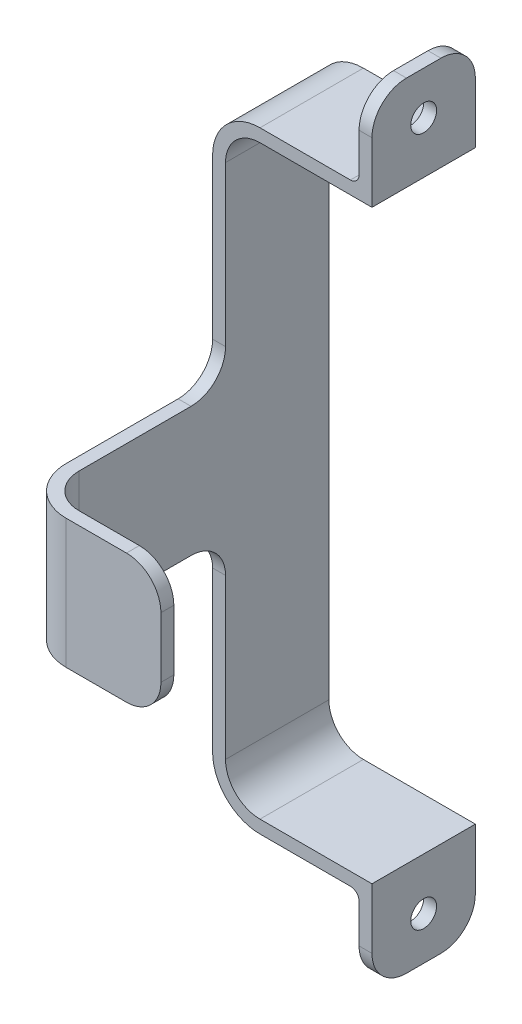
from build123d import *

# Parameters (mm, degrees)
EXTRU_MINCE1_DEPTH      = 6
EXTRU_MINCE2_DEPTH      = 7.5
CONG_1_R                = 4
CONG_2_R                = 1
ESQUISSE3_R             = 1.5
ENL_V_MAT_EXTRU_1_DEPTH = 57.387055252


with BuildPart() as part:
    # Esquisse1 → Extru.-Mince1 (new, symmetric)
    with BuildSketch(Plane.XY):
        with BuildLine():
            Line((0, -45), (0, -34))
            Line((0, -34), (-13, -34))
            ThreePointArc((-13, -34), (-15.828427125, -32.828427125), (-17, -30))
            Line((-17, -30), (-17, 30))
            ThreePointArc((-17, 30), (-15.828427125, 32.828427125), (-13, 34))
            Line((-13, 34), (0, 34))
            Line((0, 34), (0, 45))
            Line((0, 45), (-1.5, 45))
            Line((-1.5, 45), (-1.5, 35.5))
            Line((-1.5, 35.5), (-13, 35.5))
            ThreePointArc((-13, 35.5), (-16.889087297, 33.889087297), (-18.5, 30))
            Line((-18.5, 30), (-18.5, -30))
            ThreePointArc((-18.5, -30), (-16.889087297, -33.889087297), (-13, -35.5))
            Line((-13, -35.5), (-1.5, -35.5))
            Line((-1.5, -35.5), (-1.5, -45))
            Line((-1.5, -45), (0, -45))
        make_face()
    extrude(amount=EXTRU_MINCE1_DEPTH, both=True)

    # Esquisse2 → Extru.-Mince2 (add, symmetric)
    with BuildSketch(Plane(origin=(0, 0, 0), x_dir=(1, 0, 0), z_dir=(0, 1, 0))):
        with BuildLine():
            Line((-17, -6), (-17, -23))
            ThreePointArc((-17, -23), (-15.828427125, -25.828427125), (-13, -27))
            Line((-13, -27), (-2, -27))
            Line((-2, -27), (-2, -28.5))
            Line((-2, -28.5), (-13, -28.5))
            ThreePointArc((-13, -28.5), (-16.889087297, -26.889087297), (-18.5, -23))
            Line((-18.5, -23), (-18.5, -6))
            Line((-18.5, -6), (-17, -6))
        make_face()
    extrude(amount=EXTRU_MINCE2_DEPTH, both=True)

    # Congé1
    cong_1_edges = [part.edges().sort_by_distance(p)[0] for p in [
        (-0.75, 45, -6),
        (-0.75, 45, 6),
        (-2, 7.5, 27.75),
        (-2, -7.5, 27.75),
        (-0.75, -45, -6),
        (-0.75, -45, 6),
        (-17.75, -7.5, 6),
        (-17.75, 7.5, 6),
    ]]
    fillet(cong_1_edges, radius=CONG_1_R)

    # Congé2
    cong_2_edges = [part.edges().sort_by_distance(p)[0] for p in [
        (-1.5, 35.5, 0),
        (-1.5, -35.5, 0),
    ]]
    fillet(cong_2_edges, radius=CONG_2_R)

    # Esquisse3 → Enlèv. mat.-Extru.1 (cut, through all)
    with BuildSketch(Plane(origin=(0, 0, 0), x_dir=(0, 0, -1), z_dir=(1, 0, 0))):
        with Locations((0, 40)):
            Circle(ESQUISSE3_R)
        with Locations((0, -40)):
            Circle(ESQUISSE3_R)
    extrude(amount=-ENL_V_MAT_EXTRU_1_DEPTH, mode=Mode.SUBTRACT)


solid = part.part
